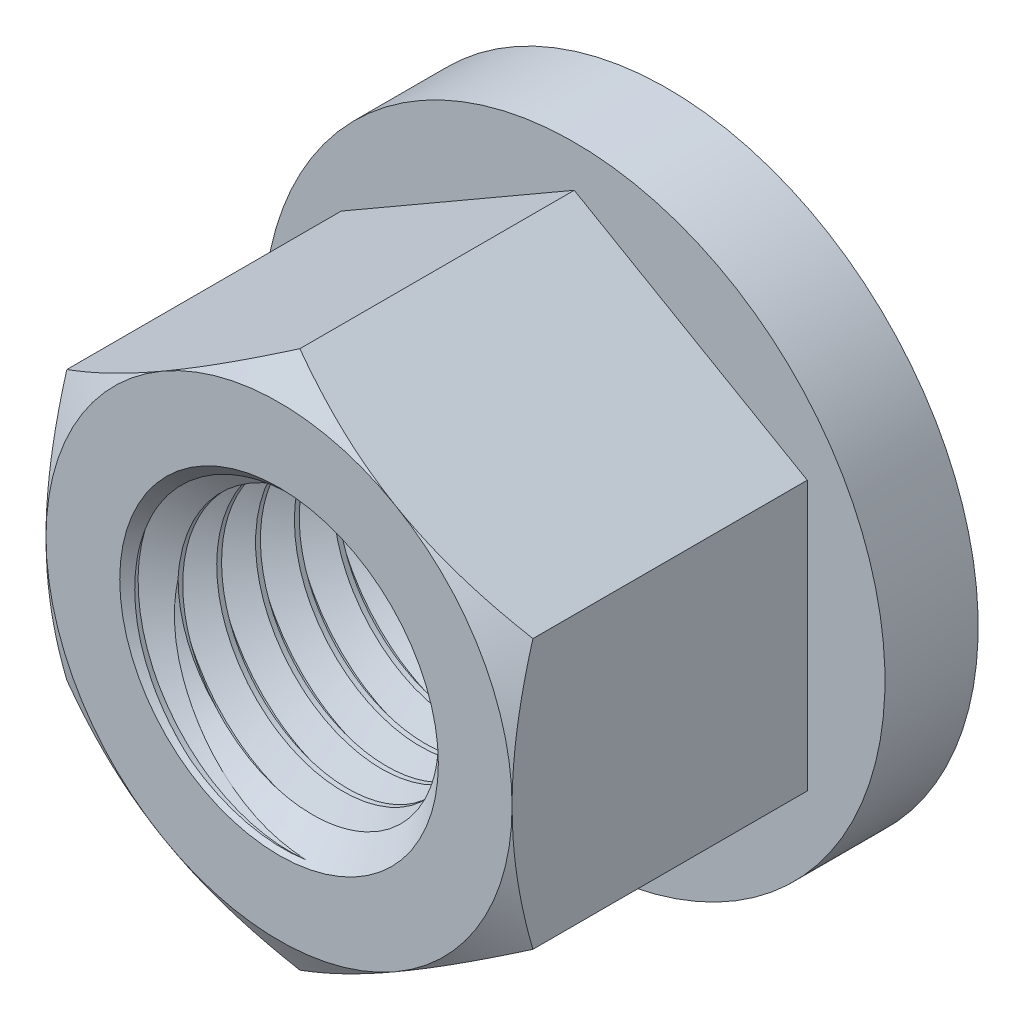
from build123d import *

# Parameters (mm, degrees)
EXTRUDE1_DEPTH     = 25
SKETCH13_R         = 20
EXTRUDE3_DEPTH     = 6
SKETCH2_OUTSIDE_W  = 188.6
SKETCH2_OUTSIDE_H  = 188.6
SKETCH2_OUTSIDE_R  = 15
CUT_EXTRUDE1_DEPTH = 38.749172176
CUT_EXTRUDE1_DRAFT = -60
SKETCH4_R          = 10
CUT_EXTRUDE3_DEPTH = 38.749172176
SKETCH12_R         = 10
SKETCH12_R_2       = 8.376202368
EXTRUDE2_DEPTH     = 25
CUT_SWEEP1_PITCH   = 2.5


with BuildPart() as part:
    # Sketch1 → Extrude1 (new body)
    with BuildSketch(Plane.XY):
        Polygon((0, 17.320508076), (-15, 8.660254038), (-15, -8.660254038), (0, -17.320508076), (15, -8.660254038), (15, 8.660254038), align=None)
    extrude(amount=-EXTRUDE1_DEPTH)

    # Sketch13 → Extrude3 (add)
    with BuildSketch(Plane(origin=(0, 0, -25), x_dir=(-1, 0, 0), z_dir=(0, 0, -1))):
        Circle(SKETCH13_R)
    extrude(amount=-EXTRUDE3_DEPTH)


with BuildPart() as cut_extrude1_tool:
    # Sketch2 outside → Cut-Extrude1 (with draft: the straight prism first)
    with BuildSketch(Plane.XY):
        Rectangle(SKETCH2_OUTSIDE_W, SKETCH2_OUTSIDE_H)
        Circle(SKETCH2_OUTSIDE_R, mode=Mode.SUBTRACT)
    extrude(amount=-CUT_EXTRUDE1_DEPTH)
    # Cut-Extrude1: the draft: its side faces are tilted about the plane it starts from
    cut_extrude1_sides = [cut_extrude1_tool.faces().sort_by_distance(p)[0] for p in [
        (0, -94.3, -19.374586088),
        (94.3, 0, -19.374586088),
        (0, 94.3, -19.374586088),
        (-94.3, 0, -19.374586088),
        (-15, 0, -19.374586088),
    ]]
    draft(cut_extrude1_sides, Plane.XY, CUT_EXTRUDE1_DRAFT)


with BuildPart() as part_1:
    add(part.part)

    # Cut-Extrude1: cut by cut_extrude1_tool
    add(cut_extrude1_tool.part, mode=Mode.SUBTRACT)

    # Sketch4 → Cut-Extrude3 (cut, through all)
    with BuildSketch(Plane.XY):
        Circle(SKETCH4_R)
    extrude(amount=-CUT_EXTRUDE3_DEPTH, mode=Mode.SUBTRACT)

    # Sketch12 → Extrude2 (add)
    with BuildSketch(Plane.XY):
        Circle(SKETCH12_R)
        Circle(SKETCH12_R_2, mode=Mode.SUBTRACT)
    extrude(amount=-EXTRUDE2_DEPTH)

    # Cut-Sweep1: the profile of Sketch9 profile screwed along a right-hand helix of 11 turns, 6 arcs to a turn; built about Z, then put on its axis
    cut_sweep1_z = Axis((0, 0, 0), (0, 0, 1))
    cut_sweep1_corners = [(10, 0, -1.25), (10, 0, -0.9375), (8.375902368, 0, 0.000173205), (8.375902368, 0, -2.187673205)]
    with BuildLine(mode=Mode.PRIVATE) as cut_sweep1_profile:
        Line(cut_sweep1_corners[0], cut_sweep1_corners[1])
        Line(cut_sweep1_corners[1], cut_sweep1_corners[2])
        Line(cut_sweep1_corners[2], cut_sweep1_corners[3])
        Line(cut_sweep1_corners[3], cut_sweep1_corners[0])
    cut_sweep1_cap = Face(cut_sweep1_profile.wire())
    cut_sweep1_turn_angles = [0, 30, 60, 90, 120, 150, 180, 210, 240, 270, 300, 330, 360]
    cut_sweep1_turn_weights = [1, 0.8660254037844387, 1, 0.8660254037844387, 1, 0.8660254037844387, 1, 0.8660254037844387, 1, 0.8660254037844387, 1, 0.8660254037844387, 1]
    cut_sweep1_turn_rails = [Edge.make_bspline([Vector(p[0], p[1], 0).rotate(cut_sweep1_z, cut_sweep1_turn_angles[k]) / cut_sweep1_turn_weights[k] + Vector(0, 0, p[2] + CUT_SWEEP1_PITCH * cut_sweep1_turn_angles[k] / 360) for k in range(13)], [0, 0, 0, 1, 1, 2, 2, 3, 3, 4, 4, 5, 5, 6, 6, 6], 2, cut_sweep1_turn_weights) for p in cut_sweep1_corners]
    cut_sweep1_turn_sides = [Face.make_surface_from_curves(cut_sweep1_turn_rails[p[0]], cut_sweep1_turn_rails[p[1]]) for p in [(0, 1), (1, 2), (2, 3), (3, 0)]]
    cut_sweep1 = Plane(origin=(0, 0, 0), x_dir=(0, 1, 0), z_dir=(0, 0, -1)) * Solid(Shell([*[p.moved(Location((0, 0, CUT_SWEEP1_PITCH * i))) for i in range(11) for p in cut_sweep1_turn_sides], cut_sweep1_cap, cut_sweep1_cap.rotate(cut_sweep1_z, 3960).moved(Location((0, 0, CUT_SWEEP1_PITCH * 3960 / 360)))]))
    add(cut_sweep1, mode=Mode.SUBTRACT)

    # Cut-Extrude6 cone 1 section (through the dimple's axis) → Cut-Extrude6 (revolve, cut)
    with BuildSketch(Plane(origin=(0, 0, 0), x_dir=(0, -1, 0), z_dir=(1, 0, 0))):
        Polygon((0, 0), (10.254, 0), (0, 10.254), align=None)
    revolve(axis=Axis((0, 0, 0), (0, 0, -1)), mode=Mode.SUBTRACT)

    # Cut-Extrude7 cone 1 section (through the dimple's axis) → Cut-Extrude7 (revolve, cut)
    with BuildSketch(Plane(origin=(0, 0, -25), x_dir=(0, 1, 0), z_dir=(1, 0, 0))):
        Polygon((0, 0), (10.254, 0), (0, 10.254), align=None)
    revolve(axis=Axis((0, 0, -25), (0, 0, 1)), mode=Mode.SUBTRACT)


solid = part_1.part
